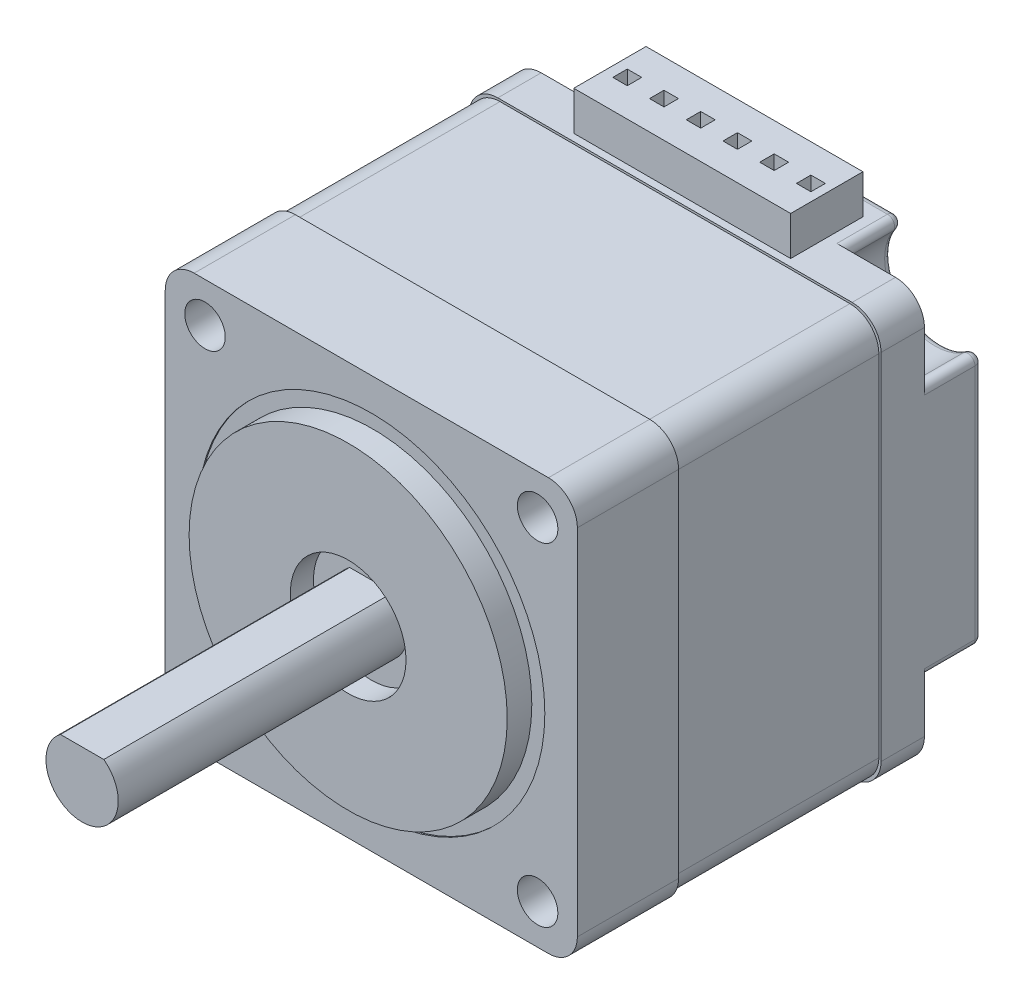
from build123d import *

# Parameters (mm, degrees)
SKETCH1_W           = 28.5
SKETCH1_H           = 28.5
BOSS_EXTRUDE1_DEPTH = 7
FILLET1_R           = 2
SKETCH2_R           = 11
BOSS_EXTRUDE2_DEPTH = 1.6
SKETCH3_R           = 4
CUT_EXTRUDE1_DEPTH  = 1.6
SKETCH4_R           = 2.5
BOSS_EXTRUDE3_DEPTH = 20
SKETCH5_W           = 4.4
SKETCH5_H           = 1
CUT_EXTRUDE2_DEPTH  = 20
SKETCH6_W           = 28.2
SKETCH6_H           = 28.2
BOSS_EXTRUDE4_DEPTH = 14
FILLET2_R           = 2
SKETCH7_W           = 28.5
SKETCH7_H           = 28.5
BOSS_EXTRUDE5_DEPTH = 7
FILLET3_R           = 2
SKETCH8_W           = 15
SKETCH8_H           = 5
BOSS_EXTRUDE6_DEPTH = 2.7
SKETCH9_R           = 1.4
CUT_EXTRUDE3_DEPTH  = 42.7
SKETCH10_R          = 3.5
CUT_EXTRUDE4_DEPTH  = 4
FILLET4_R           = 0.5
FILLET5_R           = 0.5
CUT_EXTRUDE5_START  = -0.1
SKETCH11_R          = 12
SKETCH11_R_2        = 11
CUT_EXTRUDE5_DEPTH  = 0.1
CUT_EXTRUDE6_START  = -2.5
SKETCH12_R          = 4
CUT_EXTRUDE6_DEPTH  = 2.5
BOSS_EXTRUDE7_START = 0.5
SKETCH13_R          = 2.5
BOSS_EXTRUDE7_DEPTH = 0.5
FILLET6_R           = 0.2
SKETCH14_W          = 1
SKETCH14_H          = 1
CUT_EXTRUDE7_DEPTH  = 5


with BuildPart() as part:
    # Sketch1 → Boss-Extrude1 (new body)
    with BuildSketch(Plane.XY):
        Rectangle(SKETCH1_W, SKETCH1_H)
    extrude(amount=BOSS_EXTRUDE1_DEPTH)

    # Fillet1
    fillet1_edges = [part.edges().sort_by_distance(p)[0] for p in [
        (14.25, -14.25, 3.5),
        (-14.25, -14.25, 3.5),
        (-14.25, 14.25, 3.5),
        (14.25, 14.25, 3.5),
    ]]
    fillet(fillet1_edges, radius=FILLET1_R)

    # Sketch2 → Boss-Extrude2 (add)
    with BuildSketch(Plane.XY.offset(7)):
        Circle(SKETCH2_R)
    extrude(amount=BOSS_EXTRUDE2_DEPTH)

    # Sketch3 → Cut-Extrude1 (cut)
    with BuildSketch(Plane.XY.offset(8.6)):
        Circle(SKETCH3_R)
    extrude(amount=-CUT_EXTRUDE1_DEPTH, mode=Mode.SUBTRACT)

    # Sketch4 → Boss-Extrude3 (add)
    with BuildSketch(Plane.XY.offset(7)):
        Circle(SKETCH4_R)
    extrude(amount=BOSS_EXTRUDE3_DEPTH)

    # Sketch5 → Cut-Extrude2 (cut)
    with BuildSketch(Plane.XY.offset(27)):
        with Locations((0, 2.5)):
            Rectangle(SKETCH5_W, SKETCH5_H)
    extrude(amount=-CUT_EXTRUDE2_DEPTH, mode=Mode.SUBTRACT)

    # Sketch6 → Boss-Extrude4 (add)
    with BuildSketch(Plane(origin=(0, 0, 0), x_dir=(-1, 0, 0), z_dir=(0, 0, -1))):
        Rectangle(SKETCH6_W, SKETCH6_H)
    extrude(amount=BOSS_EXTRUDE4_DEPTH)

    # Fillet2
    # the kernel refuses this fillet: 2 mm, written as the material it takes off along each edge
    with BuildSketch(Plane(origin=(-14.1, -14.1, 0), x_dir=(0, 1, 0), z_dir=(0, 0, -1)), Plane(origin=(-14.1, 14.1, 0), x_dir=(1, 0, 0), z_dir=(0, 0, -1))) as fillet2_piece_1:
        with BuildLine():
            CenterArc((FILLET2_R, FILLET2_R), FILLET2_R, 180, 90)
            Line((0, FILLET2_R), (0, 0))
            Line((0, 0), (FILLET2_R, 0))
        make_face()
    extrude(amount=19, mode=Mode.SUBTRACT)
    with BuildSketch(Plane(origin=(14.1, 14.1, 0), x_dir=(-1, 0, 0), z_dir=(0, 0, -1)), Plane(origin=(14.1, -14.1, 0), x_dir=(0, 1, 0), z_dir=(0, 0, -1))) as fillet2_piece_2:
        with BuildLine():
            CenterArc((FILLET2_R, -FILLET2_R), FILLET2_R, 90, 90)
            Line((0, -FILLET2_R), (0, 0))
            Line((0, 0), (FILLET2_R, 0))
        make_face()
    extrude(amount=19, mode=Mode.SUBTRACT)

    # Sketch7 → Boss-Extrude5 (add)
    with BuildSketch(Plane(origin=(0, 0, -14), x_dir=(-1, 0, 0), z_dir=(0, 0, -1))):
        Rectangle(SKETCH7_W, SKETCH7_H)
    extrude(amount=BOSS_EXTRUDE5_DEPTH)

    # Fillet3
    fillet3_edges = [part.edges().sort_by_distance(p)[0] for p in [
        (-14.25, -14.25, -17.5),
        (-14.25, 14.25, -17.5),
        (14.25, 14.25, -17.5),
        (14.25, -14.25, -17.5),
    ]]
    fillet(fillet3_edges, radius=FILLET3_R)

    # Sketch8 → Boss-Extrude6 (add)
    with BuildSketch(Plane(origin=(0, 14.25, 0), x_dir=(1, 0, 0), z_dir=(0, 1, 0))):
        with Locations((0, 17)):
            Rectangle(SKETCH8_W, SKETCH8_H)
    extrude(amount=BOSS_EXTRUDE6_DEPTH)

    # Sketch9 → Cut-Extrude3 (cut)
    with BuildSketch(Plane.XY.offset(7)):
        with Locations((-11.5, 11.5)):
            Circle(SKETCH9_R)
        with Locations((11.5, 11.5)):
            Circle(SKETCH9_R)
        with Locations((11.5, -11.5)):
            Circle(SKETCH9_R)
        with Locations((-11.5, -11.5)):
            Circle(SKETCH9_R)
    extrude(amount=-CUT_EXTRUDE3_DEPTH, mode=Mode.SUBTRACT)

    # Sketch10 → Cut-Extrude4 (cut)
    with BuildSketch(Plane(origin=(0, 0, -21), x_dir=(-1, 0, 0), z_dir=(0, 0, -1))):
        with Locations((-11.5, 11.5)):
            Circle(SKETCH10_R)
        with Locations((11.5, 11.5)):
            Circle(SKETCH10_R)
        with Locations((11.5, -11.5)):
            Circle(SKETCH10_R)
        with Locations((-11.5, -11.5)):
            Circle(SKETCH10_R)
    extrude(amount=-CUT_EXTRUDE4_DEPTH, mode=Mode.SUBTRACT)

    # Fillet4
    fillet4_edges = [part.edges().sort_by_distance(p)[0] for p in [
        (14.25, -9.334936491, -19),
        (9.334936491, -14.25, -19),
        (-14.25, -9.334936491, -19),
        (-9.334936491, -14.25, -19),
        (-9.334936491, 14.25, -19),
        (-14.25, 9.334936491, -19),
        (9.334936491, 14.25, -19),
        (14.25, 9.334936491, -19),
    ]]
    fillet(fillet4_edges, radius=FILLET4_R)

    # Fillet5
    fillet5_edges = [part.edges().sort_by_distance(p)[0] for p in [
        (-14.25, 0, -21),
        (9.025126266, -9.025126266, -21),
        (0, -14.25, -21),
        (-9.025126266, -9.025126266, -21),
        (-9.025126266, 9.025126266, -21),
        (0, 14.25, -21),
        (9.025126266, 9.025126266, -21),
        (14.25, 0, -21),
        (13.983853587, 8.634752599, -21),
        (8.634752599, 13.983853587, -21),
        (13.983853587, -8.634752599, -21),
        (8.634752599, -13.983853587, -21),
        (-8.634752599, -13.983853587, -21),
        (-13.983853587, -8.634752599, -21),
        (-8.634752599, 13.983853587, -21),
        (-13.983853587, 8.634752599, -21),
    ]]
    fillet(fillet5_edges, radius=FILLET5_R)

    # Sketch11 → Cut-Extrude5 (cut)
    with BuildSketch(Plane.XY.offset(7).offset(CUT_EXTRUDE5_START)):
        Circle(SKETCH11_R)
        Circle(SKETCH11_R_2, mode=Mode.SUBTRACT)
    extrude(amount=CUT_EXTRUDE5_DEPTH, mode=Mode.SUBTRACT)

    # Sketch12 → Cut-Extrude6 (cut)
    with BuildSketch(Plane(origin=(0, 0, -21), x_dir=(-1, 0, 0), z_dir=(0, 0, -1)).offset(CUT_EXTRUDE6_START)):
        with Locations(Location((0, 0, 0), (0, 0, 180))):
            Circle(SKETCH12_R)
    extrude(amount=CUT_EXTRUDE6_DEPTH, mode=Mode.SUBTRACT)

    # Sketch13 → Boss-Extrude7 (add)
    with BuildSketch(Plane(origin=(0, 0, -18.5), x_dir=(-1, 0, 0), z_dir=(0, 0, -1)).offset(BOSS_EXTRUDE7_START)):
        Circle(SKETCH13_R)
    extrude(amount=-BOSS_EXTRUDE7_DEPTH)

    # Fillet6
    fillet6_edges = [part.edges().sort_by_distance(p)[0] for p in [
        (2.5, 0, -19),
    ]]
    fillet(fillet6_edges, radius=FILLET6_R)

    # Sketch14 → Cut-Extrude7 (cut)
    with BuildSketch(Plane(origin=(0, 16.95, 0), x_dir=(1, 0, 0), z_dir=(0, 1, 0))):
        with Locations((-6.3, 17)):
            Rectangle(SKETCH14_W, SKETCH14_H)
        with Locations((-3.76, 17)):
            Rectangle(SKETCH14_W, SKETCH14_H)
        with Locations((-1.22, 17)):
            Rectangle(SKETCH14_W, SKETCH14_H)
        with Locations((1.32, 17)):
            Rectangle(SKETCH14_W, SKETCH14_H)
        with Locations((3.86, 17)):
            Rectangle(SKETCH14_W, SKETCH14_H)
        with Locations((6.4, 17)):
            Rectangle(SKETCH14_W, SKETCH14_H)
    extrude(amount=-CUT_EXTRUDE7_DEPTH, mode=Mode.SUBTRACT)


solid = part.part
